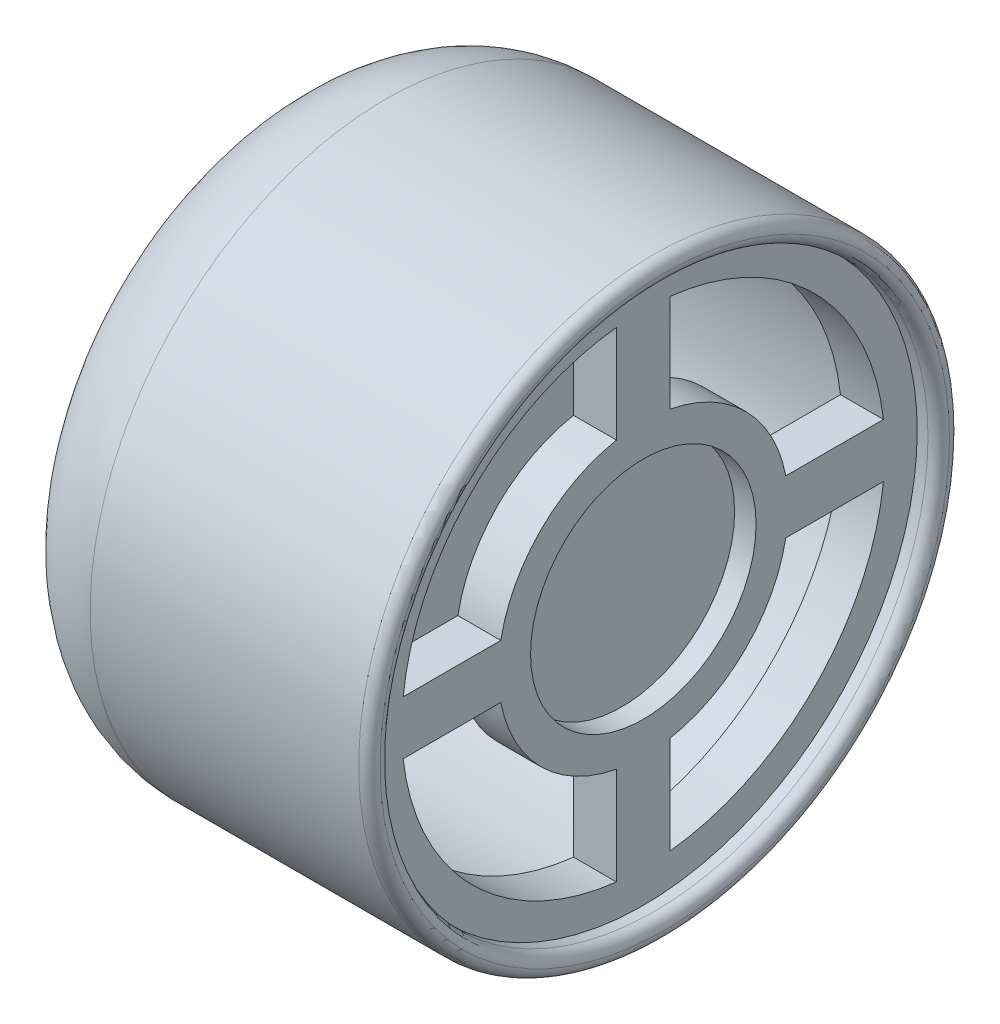
from build123d import *

# Parameters (mm, degrees)
SKETCH1_R                      = 27.505813168
SKETCH1_R_2                    = 25.505813168
BOSS_EXTRUDE1_DEPTH            = 30
SKETCH2_R                      = 27.505813168
SKETCH2_R_2                    = 25.505813168
BOSS_EXTRUDE4_DEPTH            = 6
SKETCH2_4_R                    = 25.505813168
SKETCH2_4_R_2                  = 10.5
BOSS_EXTRUDE5_DEPTH            = 4
SKETCH2_5_R                    = 10.5
BOSS_EXTRUDE6_DEPTH            = 2
SKETCH3_R                      = 27.505813168
SKETCH3_R_2                    = 25.505813168
SKETCH3_R_3                    = 21.505813168
SKETCH3_W                      = 4
SKETCH3_H                      = 13
BOSS_EXTRUDE8_DEPTH            = 6
CUT_EXTRUDE3_REACH             = 53.664
CUT_EXTRUDE4_REACH             = 55.001
SKETCH9_R                      = 1
CUT_EXTRUDE4_DIRECTION_2_DEPTH = 54.001316173
FILLET9_R                      = 10
FILLET10_R                     = 1


# Some blends are built 0.0001 mm under size
with BuildPart() as part:
    # Sketch1 → Boss-Extrude1 (new body)
    with BuildSketch(Plane.YZ):
        with Locations(Location((0, 0, 0), (0, 0, 270))):
            Circle(SKETCH1_R)
        with Locations(Location((0, 0, 0), (0, 0, 270))):
            Circle(SKETCH1_R_2, mode=Mode.SUBTRACT)
    extrude(amount=BOSS_EXTRUDE1_DEPTH)

    # Sketch2 → Boss-Extrude4 (add)
    with BuildSketch(Plane.YZ.offset(30)):
        with Locations(Location((0, 0, 0), (0, 0, 270))):
            Circle(SKETCH2_R)
        with Locations(Location((0, 0, 0), (0, 0, 270))):
            Circle(SKETCH2_R_2, mode=Mode.SUBTRACT)
    extrude(amount=BOSS_EXTRUDE4_DEPTH)

    # Sketch2<4> → Boss-Extrude5 (add)
    with BuildSketch(Plane.YZ.offset(30)):
        with Locations(Location((0, 0, 0), (0, 0, 270))):
            Circle(SKETCH2_4_R)
        with Locations(Location((0, 0, 0), (0, 0, 270))):
            Circle(SKETCH2_4_R_2, mode=Mode.SUBTRACT)
    extrude(amount=BOSS_EXTRUDE5_DEPTH)

    # Sketch2<5> → Boss-Extrude6 (add)
    with BuildSketch(Plane.YZ.offset(30)):
        with Locations(Location((0, 0, 0), (0, 0, 270))):
            Circle(SKETCH2_5_R)
    extrude(amount=BOSS_EXTRUDE6_DEPTH)

    # Sketch3 → Boss-Extrude8 (add)
    # profile 1 of 6: a face of its own
    with BuildSketch(Plane(origin=(0, 0, 0), x_dir=(0, -1, 0), z_dir=(-1, 0, 0))):
        with Locations(Location((0, 0, 0), (0, 0, 270))):
            Circle(SKETCH3_R)
        with Locations(Location((0, 0, 0), (0, 0, 270))):
            Circle(SKETCH3_R_2, mode=Mode.SUBTRACT)
    # profile 2 of 6: a face of its own
    with BuildSketch(Plane(origin=(0, 0, 0), x_dir=(0, -1, 0), z_dir=(-1, 0, 0))):
        with Locations(Location((0, 0, 0), (0, 0, 270))):
            Circle(SKETCH3_R_2)
        Circle(SKETCH3_R_3, mode=Mode.SUBTRACT)
    # profile 3 of 6: a face of its own
    with BuildSketch(Plane(origin=(0, 0, 0), x_dir=(0, -1, 0), z_dir=(-1, 0, 0))):
        with BuildLine():
            ThreePointArc((12.5, 0), (3.375390485, 12.035644523), (-10.677078252, 6.5))
            Line((-10.677078252, 6.5), (0, 6.5))
            Line((0, 6.5), (7.5, 6.5))
            Line((7.5, 6.5), (7.5, -6.5))
            Line((7.5, -6.5), (0, -6.5))
            Line((0, -6.5), (-10.677078252, -6.5))
            ThreePointArc((-10.677078252, -6.5), (3.375390485, -12.035644523), (12.5, 0))
        make_face()
    # profile 4 of 6: a face of its own
    with BuildSketch(Plane(origin=(0, 0, 0), x_dir=(0, -1, 0), z_dir=(-1, 0, 0))):
        with BuildLine():
            Line((-20.5, -6.5), (-20.5, 6.5))
            ThreePointArc((-20.5, 6.5), (-21.505813168, 0), (-20.5, -6.5))
        make_face()
    # profile 5 of 6: a face of its own
    with BuildSketch(Plane(origin=(0, 0, 0), x_dir=(0, -1, 0), z_dir=(-1, 0, 0))):
        with BuildLine():
            Line((-20.5, 6.5), (-16.5, 6.5))
            Line((-16.5, 6.5), (-10.677078252, 6.5))
            ThreePointArc((-10.677078252, 6.5), (3.375390485, 12.035644523), (12.5, 0))
            ThreePointArc((12.5, 0), (3.375390485, -12.035644523), (-10.677078252, -6.5))
            Line((-10.677078252, -6.5), (-16.5, -6.5))
            Line((-16.5, -6.5), (-20.5, -6.5))
            ThreePointArc((-20.5, -6.5), (3.288679831, -21.252872393), (21.505813168, 0))
            ThreePointArc((21.505813168, 0), (3.288679831, 21.252872393), (-20.5, 6.5))
        make_face()
    # profile 6 of 6: a face of its own
    with BuildSketch(Plane(origin=(0, 0, 0), x_dir=(0, -1, 0), z_dir=(-1, 0, 0))):
        with Locations((-18.5, 0)):
            Rectangle(SKETCH3_W, SKETCH3_H)
    extrude(amount=-BOSS_EXTRUDE8_DEPTH)

    # Sketch8 → Cut-Extrude3 (cut, up to next)
    with BuildSketch(Plane.YZ.offset(34), mode=Mode.PRIVATE) as cut_extrude3_sk1:
        with BuildLine():
            Line((-13.266499161, -2.5), (-22.360679775, -2.5))
            ThreePointArc((-22.360679775, -2.5), (-15.909902577, -15.909902577), (-2.5, -22.360679775))
            Line((-2.5, -22.360679775), (-2.5, -13.266499161))
            ThreePointArc((-2.5, -13.266499161), (-9.545941546, -9.545941546), (-13.266499161, -2.5))
        make_face()
    cut_extrude3_tool1 = extrude(cut_extrude3_sk1.sketch, amount=-CUT_EXTRUDE3_REACH, mode=Mode.PRIVATE) & part.part
    # Sketch8 → Cut-Extrude3 (cut, up to next)
    with BuildSketch(Plane.YZ.offset(34), mode=Mode.PRIVATE) as cut_extrude3_sk2:
        with BuildLine():
            Line((-2.5, 13.266499161), (-2.5, 22.360679775))
            ThreePointArc((-2.5, 22.360679775), (-15.909902577, 15.909902577), (-22.360679775, 2.5))
            Line((-22.360679775, 2.5), (-13.266499161, 2.5))
            ThreePointArc((-13.266499161, 2.5), (-9.545941546, 9.545941546), (-2.5, 13.266499161))
        make_face()
    cut_extrude3_tool2 = extrude(cut_extrude3_sk2.sketch, amount=-CUT_EXTRUDE3_REACH, mode=Mode.PRIVATE) & part.part
    # Sketch8 → Cut-Extrude3 (cut, up to next)
    with BuildSketch(Plane.YZ.offset(34), mode=Mode.PRIVATE) as cut_extrude3_sk3:
        with BuildLine():
            ThreePointArc((22.360679775, 2.5), (15.909902577, 15.909902577), (2.5, 22.360679775))
            Line((2.5, 22.360679775), (2.5, 13.266499161))
            ThreePointArc((2.5, 13.266499161), (9.545941546, 9.545941546), (13.266499161, 2.5))
            Line((13.266499161, 2.5), (22.360679775, 2.5))
        make_face()
    cut_extrude3_tool3 = extrude(cut_extrude3_sk3.sketch, amount=-CUT_EXTRUDE3_REACH, mode=Mode.PRIVATE) & part.part
    # Sketch8 → Cut-Extrude3 (cut, up to next)
    with BuildSketch(Plane.YZ.offset(34), mode=Mode.PRIVATE) as cut_extrude3_sk4:
        with BuildLine():
            ThreePointArc((2.5, -22.360679775), (15.909902577, -15.909902577), (22.360679775, -2.5))
            Line((22.360679775, -2.5), (13.266499161, -2.5))
            ThreePointArc((13.266499161, -2.5), (9.545941546, -9.545941546), (2.5, -13.266499161))
            Line((2.5, -13.266499161), (2.5, -22.360679775))
        make_face()
    cut_extrude3_tool4 = extrude(cut_extrude3_sk4.sketch, amount=-CUT_EXTRUDE3_REACH, mode=Mode.PRIVATE) & part.part
    add(cut_extrude3_tool1.solids().sort_by_distance((34, -12.15155, -12.15155))[0], mode=Mode.SUBTRACT)
    add(cut_extrude3_tool2.solids().sort_by_distance((34, -12.15155, 12.15155))[0], mode=Mode.SUBTRACT)
    add(cut_extrude3_tool3.solids().sort_by_distance((34, 12.15155, 12.15155))[0], mode=Mode.SUBTRACT)
    add(cut_extrude3_tool4.solids().sort_by_distance((34, 12.15155, -12.15155))[0], mode=Mode.SUBTRACT)

    # Sketch9 → Cut-Extrude4 (cut, up to next)
    with BuildSketch(Plane(origin=(0, 0, 0), x_dir=(0, -1, 0), z_dir=(-1, 0, 0)), mode=Mode.PRIVATE) as cut_extrude4_sk1:
        with Locations(Location((-10.5, 10.5, 0), (0, 0, 270))):
            Circle(SKETCH9_R)
    cut_extrude4_tool1 = extrude(cut_extrude4_sk1.sketch, amount=-CUT_EXTRUDE4_REACH, mode=Mode.PRIVATE) & part.part
    # Sketch9 → Cut-Extrude4 (cut, up to next)
    with BuildSketch(Plane(origin=(0, 0, 0), x_dir=(0, -1, 0), z_dir=(-1, 0, 0)), mode=Mode.PRIVATE) as cut_extrude4_sk2:
        with Locations(Location((10.5, 10.5, 0), (0, 0, 270))):
            Circle(SKETCH9_R)
    cut_extrude4_tool2 = extrude(cut_extrude4_sk2.sketch, amount=-CUT_EXTRUDE4_REACH, mode=Mode.PRIVATE) & part.part
    # Sketch9 → Cut-Extrude4 (cut, up to next)
    with BuildSketch(Plane(origin=(0, 0, 0), x_dir=(0, -1, 0), z_dir=(-1, 0, 0)), mode=Mode.PRIVATE) as cut_extrude4_sk3:
        with Locations(Location((10.5, -10.5, 0), (0, 0, 270))):
            Circle(SKETCH9_R)
    cut_extrude4_tool3 = extrude(cut_extrude4_sk3.sketch, amount=-CUT_EXTRUDE4_REACH, mode=Mode.PRIVATE) & part.part
    # Sketch9 → Cut-Extrude4 (cut, up to next)
    with BuildSketch(Plane(origin=(0, 0, 0), x_dir=(0, -1, 0), z_dir=(-1, 0, 0)), mode=Mode.PRIVATE) as cut_extrude4_sk4:
        with Locations(Location((-10.5, -10.5, 0), (0, 0, 270))):
            Circle(SKETCH9_R)
    cut_extrude4_tool4 = extrude(cut_extrude4_sk4.sketch, amount=-CUT_EXTRUDE4_REACH, mode=Mode.PRIVATE) & part.part
    add(cut_extrude4_tool1.solids().sort_by_distance((0, 10.5, 10.5))[0], mode=Mode.SUBTRACT)
    add(cut_extrude4_tool2.solids().sort_by_distance((0, -10.5, 10.5))[0], mode=Mode.SUBTRACT)
    add(cut_extrude4_tool3.solids().sort_by_distance((0, -10.5, -10.5))[0], mode=Mode.SUBTRACT)
    add(cut_extrude4_tool4.solids().sort_by_distance((0, 10.5, -10.5))[0], mode=Mode.SUBTRACT)

    # Sketch9 → Cut-Extrude4 direction 2 (cut)
    with BuildSketch(Plane(origin=(0, 0, 0), x_dir=(0, -1, 0), z_dir=(-1, 0, 0))):
        with Locations(Location((-10.5, 10.5, 0), (0, 0, 270))):
            Circle(SKETCH9_R)
        with Locations(Location((10.5, 10.5, 0), (0, 0, 270))):
            Circle(SKETCH9_R)
        with Locations(Location((10.5, -10.5, 0), (0, 0, 270))):
            Circle(SKETCH9_R)
        with Locations(Location((-10.5, -10.5, 0), (0, 0, 270))):
            Circle(SKETCH9_R)
    extrude(amount=CUT_EXTRUDE4_DIRECTION_2_DEPTH, mode=Mode.SUBTRACT)

    # Fillet9
    # the kernel refuses this fillet: 10 mm, written as the material it takes off along each edge
    with BuildSketch(Plane(origin=(0, 0, 0), x_dir=(0, 0, -1), z_dir=(0, -1, 0))) as fillet9_piece_1:
        with BuildLine():
            CenterArc((27.505813168 - FILLET9_R, FILLET9_R), FILLET9_R, 270, 90)
            Line((27.505813168 - FILLET9_R, 0), (27.505813168, 0))
            Line((27.505813168, 0), (27.505813168, FILLET9_R))
        make_face()
    revolve(axis=Axis((0, 0, 0), (1, 0, 0)), mode=Mode.SUBTRACT)

    # Fillet10
    fillet10_edges = [part.edges().sort_by_distance(p)[0] for p in [
        (36, 0, 27.505813168),
        (36, 0, 25.505813168),
    ]]
    fillet(fillet10_edges, radius=FILLET10_R - 0.0001)  # a hair under: the kernel refuses the full size


solid = part.part
